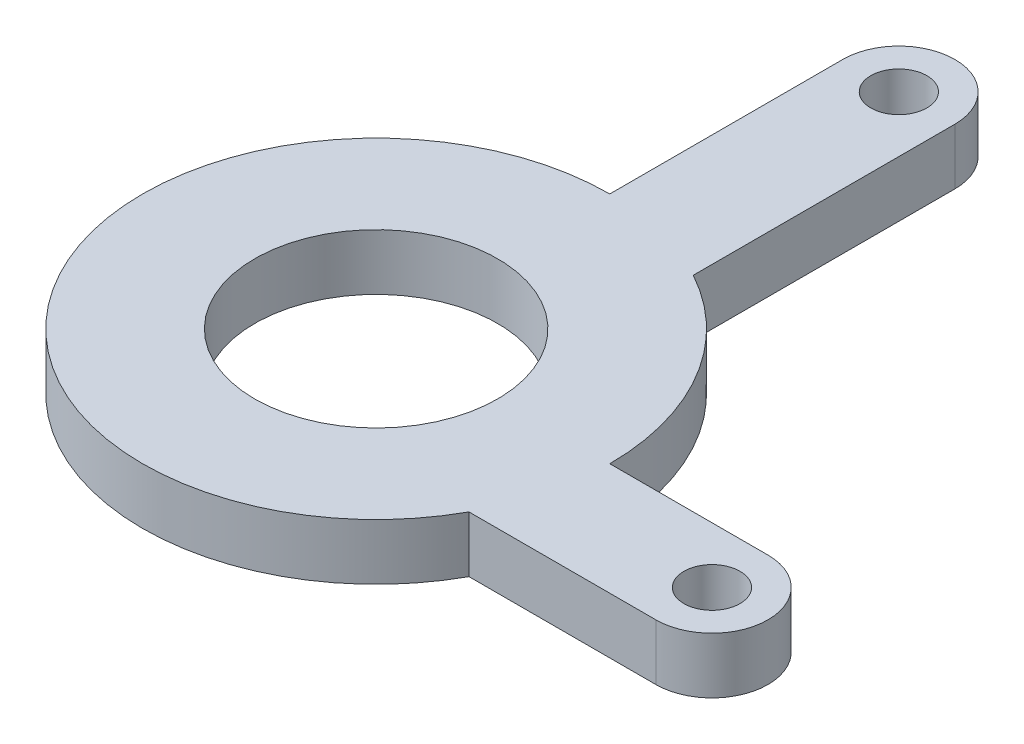
from build123d import *

# Parameters (mm, degrees)
SKETCH1_R           = 6.5
SKETCH1_R_2         = 1.5
BOSS_EXTRUDE1_DEPTH = 3


with BuildPart() as part:
    # Sketch1 → Boss-Extrude1 (new body)
    with BuildSketch(Plane(origin=(0, 0, 0), x_dir=(1, 0, 0), z_dir=(0, 1, 0))):
        with BuildLine():
            Line((0, 24.9658561), (0, 12.5))
            ThreePointArc((0, 12.5), (-10.752906584, -6.373774392), (10.9658561, -6))
            Line((10.9658561, -6), (20.9658561, -6))
            ThreePointArc((20.9658561, -6), (23.9658561, -3), (20.9658561, 0))
            Line((20.9658561, 0), (12.5, 0))
            ThreePointArc((12.5, 0), (10.752906584, 6.373774392), (6, 10.9658561))
            Line((6, 10.9658561), (6, 24.9658561))
            ThreePointArc((6, 24.9658561), (3, 27.9658561), (0, 24.9658561))
        make_face()
        Circle(SKETCH1_R, mode=Mode.SUBTRACT)
        with Locations((20.9658561, -3)):
            Circle(SKETCH1_R_2, mode=Mode.SUBTRACT)
        with Locations((3, 24.9658561)):
            Circle(SKETCH1_R_2, mode=Mode.SUBTRACT)
    extrude(amount=BOSS_EXTRUDE1_DEPTH)


solid = part.part
